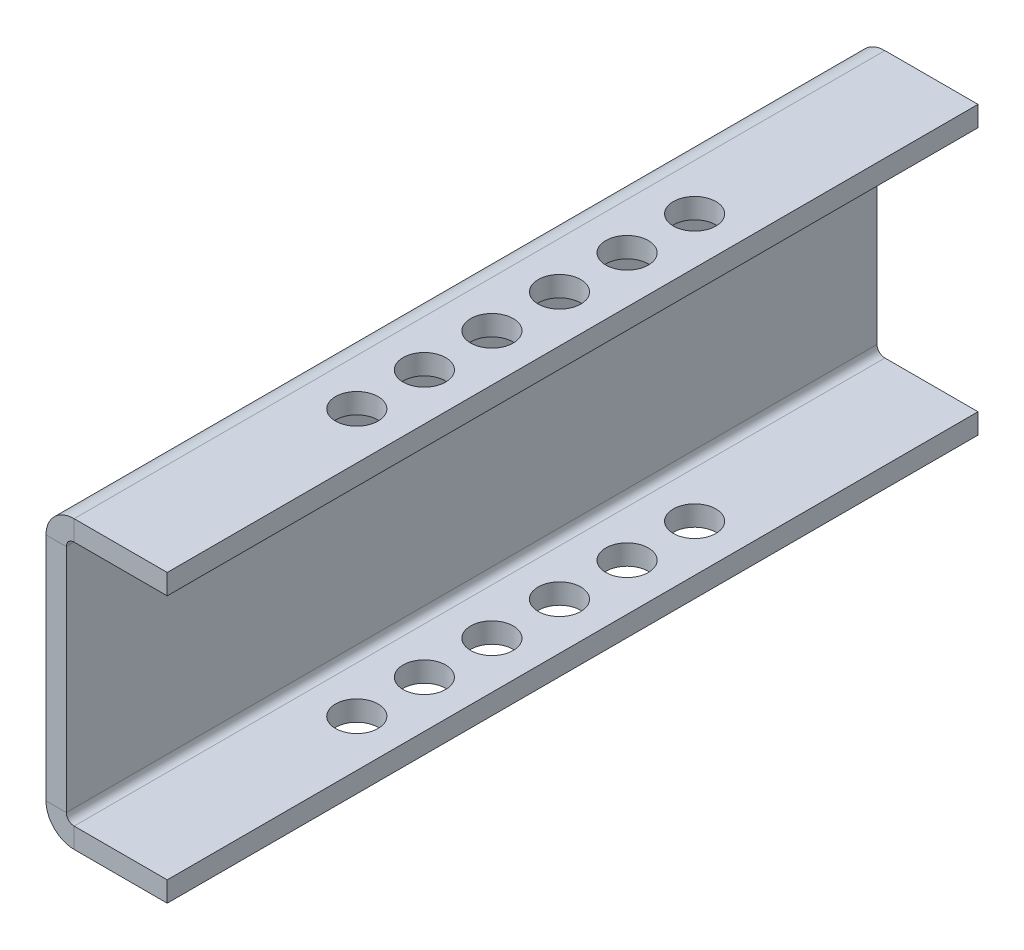
from build123d import *

# Parameters (mm, degrees)
SKETCH4_W              = 76.2
SKETCH4_H              = 44.45
BASE_FLANGE1_DEPTH     = 1.905
SKETCHED_START         = -38.1
SKETCHED_BEND3_DEPTH   = 76.2
SKETCHED_BEND3_2_DEPTH = 76.2
CUT_EXTRUDE2_REACH     = 49.608
SKETCH20_R             = 2


# Read off the part's stored shape, not the designer's step: Sketched Bend3
# Sheet-metal steps are written as plain solids
with BuildPart() as part:
    # Sketch4 → Base-Flange1 (new body)
    with BuildSketch(Plane(origin=(0, 0, 0), x_dir=(0, 0, -1), z_dir=(1, 0, 0))):
        Rectangle(SKETCH4_W, SKETCH4_H)
    extrude(amount=-BASE_FLANGE1_DEPTH)

    # Sketched Bend3 outline → Sketched Bend3 (cut)
    with BuildSketch(Plane.XY.offset(SKETCHED_START)):
        with BuildLine():
            ThreePointArc((0, -13.357223013), (-1.375727285, -12.406629491), (-1.905, -10.8204))
            Line((-1.905, -10.8204), (-1.905, -22.225))
            Line((-1.905, -22.225), (0, -22.225))
            Line((0, -22.225), (0, -13.357223013))
        make_face()
        with BuildLine():
            Line((-1.905, 22.225), (-1.905, 10.8204))
            ThreePointArc((-1.905, 10.8204), (-1.375727285, 12.406629491), (0, 13.357223013))
            Line((0, 13.357223013), (0, 22.225))
            Line((0, 22.225), (-1.905, 22.225))
        make_face()
    extrude(amount=SKETCHED_BEND3_DEPTH, mode=Mode.SUBTRACT)

    # Sketched Bend3 2 outline → Sketched Bend3 2 (add)
    with BuildSketch(Plane.XY.offset(SKETCHED_START)):
        with BuildLine():
            Line((0, -10.8204), (0, -13.357223013))
            ThreePointArc((0, -13.357223013), (0.364592683, -13.435674577), (0.7366, -13.462))
            Line((0.7366, -13.462), (9.487967924, -13.462))
            Line((9.487967924, -13.462), (9.487967924, -11.557))
            Line((9.487967924, -11.557), (0.7366, -11.557))
            ThreePointArc((0.7366, -11.557), (0.215745145, -11.341254855), (0, -10.8204))
        make_face()
        with BuildLine():
            ThreePointArc((0.7366, 13.462), (0.364592683, 13.435674577), (0, 13.357223013))
            Line((0, 13.357223013), (0, 10.8204))
            ThreePointArc((0, 10.8204), (0.215745145, 11.341254855), (0.7366, 11.557))
            Line((0.7366, 11.557), (9.487967924, 11.557))
            Line((9.487967924, 11.557), (9.487967924, 13.462))
            Line((9.487967924, 13.462), (0.7366, 13.462))
        make_face()
    extrude(amount=SKETCHED_BEND3_2_DEPTH)

    # Cut-Extrude2: up to this face of the body (flat: up to its plane)
    cut_extrude2_end = Plane(part.part.faces().sort_by_distance((5.112283962, -13.462, 0))[0])
    # Sketch20 → Cut-Extrude2 (cut, up to the picked face)
    with BuildSketch(Plane(origin=(0, 13.462, 0), x_dir=(1, 0, 0), z_dir=(0, 1, 0)), mode=Mode.PRIVATE) as cut_extrude2_sk1:
        with Locations(Location((5.08, -3.175, 0), (0, 0, 180))):
            Circle(SKETCH20_R)
    cut_extrude2_tool1 = split(extrude(cut_extrude2_sk1.sketch, amount=-CUT_EXTRUDE2_REACH, mode=Mode.PRIVATE), bisect_by=cut_extrude2_end, keep=Keep.BOTH, mode=Mode.PRIVATE)
    # Sketch20 → Cut-Extrude2 (cut, up to the picked face)
    with BuildSketch(Plane(origin=(0, 13.462, 0), x_dir=(1, 0, 0), z_dir=(0, 1, 0)), mode=Mode.PRIVATE) as cut_extrude2_sk2:
        with Locations(Location((5.08, 3.175, 0), (0, 0, 180))):
            Circle(SKETCH20_R)
    cut_extrude2_tool2 = split(extrude(cut_extrude2_sk2.sketch, amount=-CUT_EXTRUDE2_REACH, mode=Mode.PRIVATE), bisect_by=cut_extrude2_end, keep=Keep.BOTH, mode=Mode.PRIVATE)
    # Sketch20 → Cut-Extrude2 (cut, up to the picked face)
    with BuildSketch(Plane(origin=(0, 13.462, 0), x_dir=(1, 0, 0), z_dir=(0, 1, 0)), mode=Mode.PRIVATE) as cut_extrude2_sk3:
        with Locations(Location((5.08, 9.525, 0), (0, 0, 180))):
            Circle(SKETCH20_R)
    cut_extrude2_tool3 = split(extrude(cut_extrude2_sk3.sketch, amount=-CUT_EXTRUDE2_REACH, mode=Mode.PRIVATE), bisect_by=cut_extrude2_end, keep=Keep.BOTH, mode=Mode.PRIVATE)
    # Sketch20 → Cut-Extrude2 (cut, up to the picked face)
    with BuildSketch(Plane(origin=(0, 13.462, 0), x_dir=(1, 0, 0), z_dir=(0, 1, 0)), mode=Mode.PRIVATE) as cut_extrude2_sk4:
        with Locations(Location((5.08, 15.875, 0), (0, 0, 180))):
            Circle(SKETCH20_R)
    cut_extrude2_tool4 = split(extrude(cut_extrude2_sk4.sketch, amount=-CUT_EXTRUDE2_REACH, mode=Mode.PRIVATE), bisect_by=cut_extrude2_end, keep=Keep.BOTH, mode=Mode.PRIVATE)
    # Sketch20 → Cut-Extrude2 (cut, up to the picked face)
    with BuildSketch(Plane(origin=(0, 13.462, 0), x_dir=(1, 0, 0), z_dir=(0, 1, 0)), mode=Mode.PRIVATE) as cut_extrude2_sk5:
        with Locations(Location((5.08, -9.525, 0), (0, 0, 180))):
            Circle(SKETCH20_R)
    cut_extrude2_tool5 = split(extrude(cut_extrude2_sk5.sketch, amount=-CUT_EXTRUDE2_REACH, mode=Mode.PRIVATE), bisect_by=cut_extrude2_end, keep=Keep.BOTH, mode=Mode.PRIVATE)
    # Sketch20 → Cut-Extrude2 (cut, up to the picked face)
    with BuildSketch(Plane(origin=(0, 13.462, 0), x_dir=(1, 0, 0), z_dir=(0, 1, 0)), mode=Mode.PRIVATE) as cut_extrude2_sk6:
        with Locations(Location((5.08, -15.875, 0), (0, 0, 180))):
            Circle(SKETCH20_R)
    cut_extrude2_tool6 = split(extrude(cut_extrude2_sk6.sketch, amount=-CUT_EXTRUDE2_REACH, mode=Mode.PRIVATE), bisect_by=cut_extrude2_end, keep=Keep.BOTH, mode=Mode.PRIVATE)
    add(cut_extrude2_tool1.solids().sort_by(Axis((5.08, 13.462, 3.175), (0, -1, 0)))[0], mode=Mode.SUBTRACT)
    add(cut_extrude2_tool2.solids().sort_by(Axis((5.08, 13.462, -3.175), (0, -1, 0)))[0], mode=Mode.SUBTRACT)
    add(cut_extrude2_tool3.solids().sort_by(Axis((5.08, 13.462, -9.525), (0, -1, 0)))[0], mode=Mode.SUBTRACT)
    add(cut_extrude2_tool4.solids().sort_by(Axis((5.08, 13.462, -15.875), (0, -1, 0)))[0], mode=Mode.SUBTRACT)
    add(cut_extrude2_tool5.solids().sort_by(Axis((5.08, 13.462, 9.525), (0, -1, 0)))[0], mode=Mode.SUBTRACT)
    add(cut_extrude2_tool6.solids().sort_by(Axis((5.08, 13.462, 15.875), (0, -1, 0)))[0], mode=Mode.SUBTRACT)


solid = part.part
